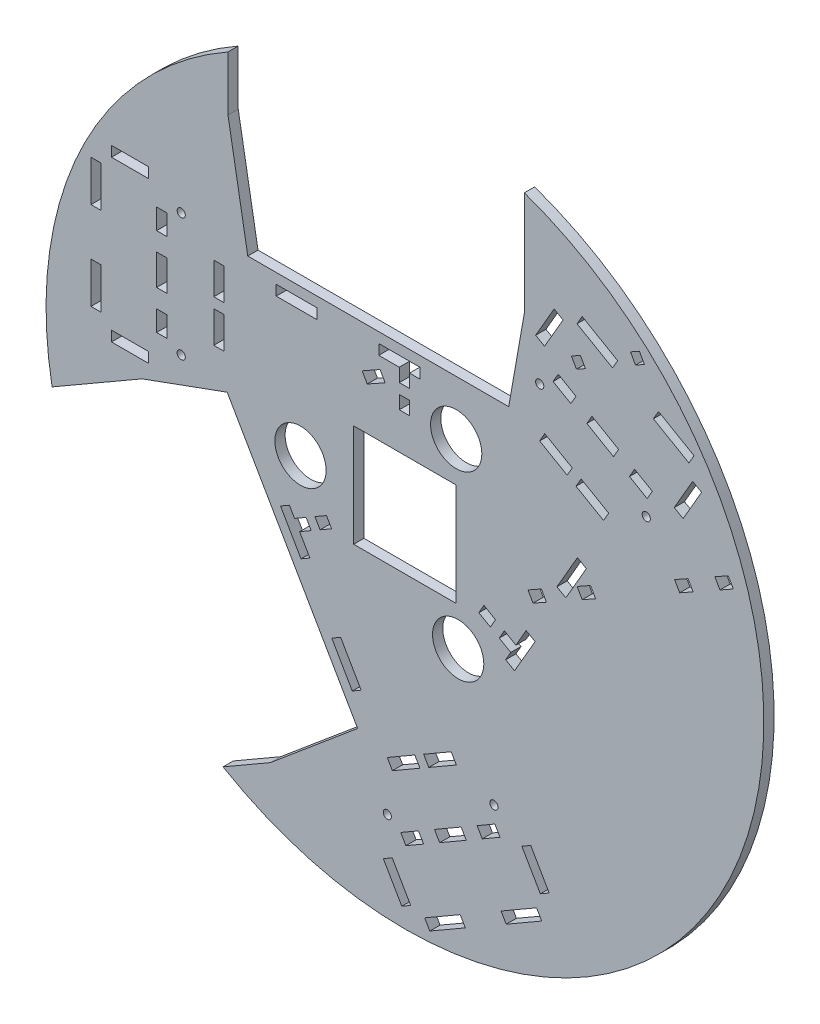
from build123d import *

# Parameters (mm, degrees)
ESQUISSE1_R                = 175
BOSS_EXTRU_1_DEPTH         = 5
ESQUISSE2_W                = 18
ESQUISSE2_H                = 5
ESQUISSE2_W_2              = 5
ESQUISSE2_H_2              = 20
ESQUISSE2_H_3              = 10
ESQUISSE2_H_4              = 15
ESQUISSE2_H_5              = 15.5
ESQUISSE2_W_3              = 20
ESQUISSE2_H_6              = 6.5
ENL_V_MAT_EXTRU_1_DEPTH    = 5
ESQUISSE6_R                = 12.5
ESQUISSE6_W                = 50
ESQUISSE6_H                = 50
ENL_V_MAT_EXTRU_6_DEPTH    = 5
TROUS_DE_CENTRAGE_4_0MM1_D = 4
ENL_V_MAT_EXTRU_7_DEPTH    = 10


with BuildPart() as part:
    # Esquisse1 → Boss.-Extru.1 (new body)
    with BuildSketch(Plane.XY):
        with Locations((148.080426897, -12.110171348)):
            Circle(ESQUISSE1_R)
    extrude(amount=BOSS_EXTRU_1_DEPTH)

    # Esquisse2 → Enlèv. mat.-Extru.1 (cut)
    with BuildSketch(Plane.XY.offset(5)):
        Polygon((135.311788567, 53.777441362), (135.311788567, 48.777441362), (145.311788567, 48.777441362), (145.311788567, 42.277441362), (150.311788567, 42.277441362), (150.311788567, 48.777441362), (155.311788567, 48.777441362), (155.311788567, 53.777441362), align=None)
        with Locations((14, 69.777441362)):
            Rectangle(ESQUISSE2_W, ESQUISSE2_H)
        with Locations((-2.5, 52.277441362)):
            Rectangle(ESQUISSE2_W_2, ESQUISSE2_H_2)
        with Locations((-2.5, 9.277441362)):
            Rectangle(ESQUISSE2_W_2, ESQUISSE2_H_2)
        with Locations((14, -8.222558638)):
            Rectangle(ESQUISSE2_W, ESQUISSE2_H)
        with Locations((29.5, 9.277441362)):
            Rectangle(ESQUISSE2_W_2, ESQUISSE2_H_3)
        with Locations((29.5, 30.777441362)):
            Rectangle(ESQUISSE2_W_2, ESQUISSE2_H_4)
        with Locations((29.5, 52.277441362)):
            Rectangle(ESQUISSE2_W_2, ESQUISSE2_H_3)
        with Locations((57.36, 41.027441362)):
            Rectangle(ESQUISSE2_W_2, ESQUISSE2_H_5)
        with Locations((57.36, 20.527441362)):
            Rectangle(ESQUISSE2_W_2, ESQUISSE2_H_5)
        with Locations((95.311788567, 51.277441362)):
            Rectangle(ESQUISSE2_W_3, ESQUISSE2_H)
        with Locations((147.811788567, 34.027441362)):
            Rectangle(ESQUISSE2_W_2, ESQUISSE2_H_6)
        Polygon((292.702456717, 69.607306773), (283.702456717, 54.018849505), (279.372329698, 56.518849505), (288.372329698, 72.107306773), align=None)
        Polygon((289.042202679, 83.267560811), (286.542202679, 78.937433792), (269.221694603, 88.937433792), (271.721694603, 93.267560811), align=None)
        Polygon((251.803110316, 104.767560811), (249.303110316, 100.437433792), (231.982602241, 110.437433792), (234.482602241, 114.767560811), align=None)
        Polygon((225.152475222, 108.607306773), (216.152475222, 93.018849505), (211.822348203, 95.518849505), (220.822348203, 111.107306773), align=None)
        Polygon((231.472983297, 79.55474789), (228.972983297, 75.224620871), (220.31272926, 80.224620871), (222.81272926, 84.55474789), align=None)
        Polygon((252.257592988, 67.55474789), (249.757592988, 63.224620871), (236.767211932, 70.724620871), (239.267211932, 75.05474789), align=None)
        Polygon((268.71207566, 58.05474789), (266.21207566, 53.724620871), (257.551821622, 58.724620871), (260.051821622, 63.05474789), align=None)
        Polygon((247.420859728, 38.17728014), (244.920859728, 33.847153121), (231.497465969, 41.597153121), (233.997465969, 45.92728014), align=None)
        Polygon((229.66733895, 48.42728014), (227.16733895, 44.097153121), (213.743945192, 51.847153121), (216.243945192, 56.17728014), align=None)
        Polygon((211.525092463, -33.996012539), (207.194965444, -31.496012539), (202.194965444, -40.156266577), (196.56580032, -36.906266577), (194.06580032, -41.236393596), (199.694965444, -44.486393596), (197.194965444, -48.816520615), (201.525092463, -51.316520615), align=None)
        Polygon((236.525092463, 9.30525765), (226.525092463, -8.015250425), (222.194965444, -5.515250425), (232.194965444, 11.80525765), align=None)
        Polygon((192.235673301, -34.406266577), (189.735673301, -38.736393596), (184.106508176, -35.486393596), (186.606508176, -31.156266577), align=None)
        Polygon((146.538823973, -178.215262181), (137.538823973, -162.626804912), (141.868950992, -160.126804912), (150.868950992, -175.715262181), align=None)
        Polygon((160.199078011, -181.875516218), (157.699078011, -177.545389199), (175.019586086, -167.545389199), (177.519586086, -171.875516218), align=None)
        Polygon((197.438170373, -160.375516218), (194.938170373, -156.045389199), (212.258678449, -146.045389199), (214.758678449, -150.375516218), align=None)
        Polygon((214.088805468, -139.215262181), (205.088805468, -123.626804912), (209.418932487, -121.126804912), (218.418932487, -136.715262181), align=None)
        Polygon((185.768297392, -130.162703297), (183.268297392, -125.832576278), (191.92855143, -120.832576278), (194.42855143, -125.162703297), align=None)
        Polygon((164.983687701, -142.162703297), (162.483687701, -137.832576278), (175.474068758, -130.332576278), (177.974068758, -134.662703297), align=None)
        Polygon((148.52920503, -151.662703297), (146.02920503, -147.332576278), (154.689459067, -142.332576278), (157.189459067, -146.662703297), align=None)
        Polygon((141.960420962, -123.285235548), (139.460420962, -118.955108529), (152.88381472, -111.205108529), (155.38381472, -115.535235548), align=None)
        Polygon((159.713941739, -113.035235548), (157.213941739, -108.705108529), (170.637335498, -100.955108529), (173.137335498, -105.285235548), align=None)
        Polygon((97.404399659, -56.111942869), (101.734526678, -53.611942869), (96.734526678, -44.951688831), (102.363691803, -41.701688831), (99.863691803, -37.371561812), (94.234526678, -40.621561812), (91.734526678, -36.291434793), (87.404399659, -38.791434793), align=None)
        Polygon((122.404399659, -99.413213058), (112.404399659, -82.092704982), (116.734526678, -79.592704982), (126.734526678, -96.913213058), align=None)
        Polygon((106.693818822, -39.201688831), (104.193818822, -34.871561812), (109.822983946, -31.621561812), (112.322983946, -35.951688831), align=None)
    extrude(amount=-ENL_V_MAT_EXTRU_1_DEPTH, mode=Mode.SUBTRACT)

    # Esquisse6 → Enlèv. mat.-Extru.6 (cut)
    with BuildSketch(Plane.XY.offset(5)):
        with Locations((173.06, 32.277441362)):
            Circle(ESQUISSE6_R)
        with Locations((174.031440566, -55.936922587)):
            Circle(ESQUISSE6_R)
        with Locations((97.149840124, -12.67103282)):
            Circle(ESQUISSE6_R)
        Polygon((206.321253746, 102.221853729), (206.321253746, 185.563712918), (61.797190042, 185.563712918), (61.797190042, 113.486217733), (71.443823398, 58.777441362), (198.660831685, 58.777441362), align=None)
        with Locations((148.080426897, -12.110171348)):
            Rectangle(ESQUISSE6_W, ESQUISSE6_H)
        Polygon((19.945575289, -18.838148298), (-52.230591968, -60.509077893), (20.031439884, -185.670588519), (82.452381756, -149.631840926), (125.008255225, -113.923223194), (61.399751081, -3.750062223), align=None)
    extrude(amount=-ENL_V_MAT_EXTRU_6_DEPTH, mode=Mode.SUBTRACT)

    # Trous de centrage Ø4.0mm1 (through all)
    with Locations(Plane(origin=(148.080426897, -12.110171348, -78), x_dir=(1, 0, 0), z_dir=(0, 0, -1))):
        with Locations((65.70121345, -88.022614393), (117.662737677, -58.022614393), (-109.080426897, -72.887612711), (-109.080426897, -12.887612711), (-8.58231078, 130.910227103), (43.379213447, 100.910227103)):
            Hole(TROUS_DE_CENTRAGE_4_0MM1_D / 2)

    # Esquisse9 → Enlèv. mat.-Extru.7 (cut)
    with BuildSketch(Plane.XY.offset(5)):
        Polygon((301.647255965, 32.874727734), (299.200467122, 37.235143352), (305.741090548, 40.905326617), (308.187879391, 36.544910999), align=None)
        Polygon((282.025385687, 21.864177939), (279.578596844, 26.224593557), (286.11922027, 29.894776822), (288.566009113, 25.534361204), align=None)
        Polygon((241.037478884, -1.135637188), (238.590690041, 3.224778429), (232.050066614, -0.445404836), (234.496855458, -4.805820453), align=None)
        Polygon((214.608404145, -10.232560209), (217.055192988, -14.592975826), (210.514569562, -18.263159091), (208.067780719, -13.902743474), align=None)
        Polygon((264.848302808, 109.693260957), (260.48788719, 107.246472114), (258.041098347, 111.606887731), (262.401513964, 114.053676575), align=None)
        Polygon((236.069559733, 93.544454591), (231.709144116, 91.097665748), (229.262355272, 95.458081365), (233.62277089, 97.904870209), align=None)
        Polygon((138.396249904, 38.736384501), (129.675418669, 33.842806814), (127.228629826, 38.203222431), (135.949461061, 43.096800118), align=None)
    extrude(amount=-ENL_V_MAT_EXTRU_7_DEPTH, mode=Mode.SUBTRACT)


solid = part.part
